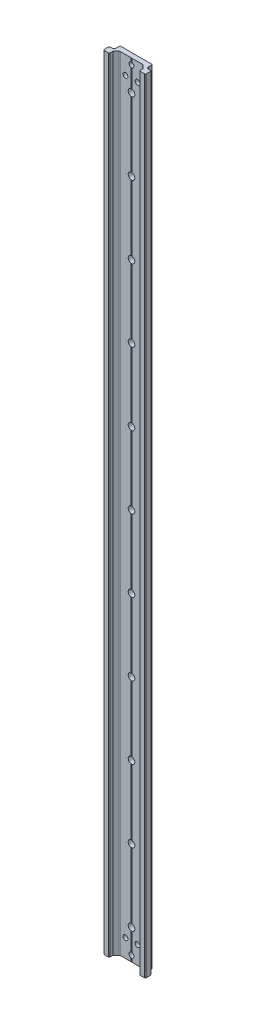
from build123d import *
from OCP.BRepFilletAPI import BRepFilletAPI_MakeChamfer

# Parameters (mm, degrees)
BOSS_EXTRU_1_DEPTH                  = 650
ENL_V_MAT_EXTRU_1_DEPTH             = 651.254758327
ENL_V_MAT_EXTRU_2_DEPTH             = 650
ENL_V_MAT_EXTRU_3_DEPTH             = 651.254758327
ENL_V_MAT_EXTRU_4_DEPTH             = 650
DIAM_TRE_DU_PER_AGE_5_5_5_5_1_D     = 5.5
DIAM_TRE_DU_PER_AGE_5_5_5_5_1_DEPTH = 9.900000103
CHANFREIN1_SIZE                     = 0.5
CHANFREIN1_SIZE2                    = 0.499999975
CHANFREIN2_SIZE                     = 0.3
CHANFREIN3_SIZE                     = 0.499999997
CHANFREIN3_SIZE2                    = 0.500000028
CHANFREIN4_SIZE                     = 0.5
CHANFREIN4_SIZE2                    = 0.500000014
CONG_1_R                            = 1.499999963
CONG_2_R                            = 1.999999944
ESQUISSE8_R                         = 2
ESQUISSE8_R_2                       = 2.093247616
ENL_V_MAT_EXTRU_5_DEPTH             = 10


with BuildPart() as part:
    # Esquisse1 → Boss.-Extru.1 (new body)
    with BuildSketch(Plane(origin=(0, 325, 0), x_dir=(1, 0, 0), z_dir=(0, 1, 0))):
        Polygon((-9.70002034, 1.00000045), (9.70002034, 1.00000045), (12.50002072, -1.79999993), (12.50002072, -4.999999928), (17.50002072, -4.999999928), (17.50002072, 5.000000175), (-17.50002072, 5.000000175), (-17.50002072, -4.999999928), (-12.50002072, -4.999999928), (-12.50002072, -1.79999993), align=None)
    extrude(amount=-BOSS_EXTRU_1_DEPTH)

    # Esquisse2 → Enlèv. mat.-Extru.1 (cut, through all)
    with BuildSketch(Plane.XZ.offset(325)):
        Polygon((-14.30002069, -6.7e-08), (-17.50002072, -6.7e-08), (-17.50002072, -5.000000175), (-13.50002072, -5.000000175), (-13.50002072, -0.799999947), align=None)
    extrude(amount=-ENL_V_MAT_EXTRU_1_DEPTH, mode=Mode.SUBTRACT)

    # Esquisse3 → Enlèv. mat.-Extru.2 (cut)
    with BuildSketch(Plane.XZ.offset(325)):
        Polygon((0.25, -1.000000175), (-0.25, -1.000000175), (1e-09, -1.144337743), align=None)
    extrude(amount=-ENL_V_MAT_EXTRU_2_DEPTH, mode=Mode.SUBTRACT)

    # Esquisse4 → Enlèv. mat.-Extru.3 (cut, through all)
    with BuildSketch(Plane.XZ.offset(325)):
        Polygon((13.50002072, -0.799999925), (13.50002072, -5.000000175), (17.50002072, -5.000000175), (17.50002072, 7.5e-08), (14.30002072, 7.5e-08), align=None)
    extrude(amount=-ENL_V_MAT_EXTRU_3_DEPTH, mode=Mode.SUBTRACT)

    # Esquisse5 → Enlèv. mat.-Extru.4 (cut)
    with BuildSketch(Plane.XZ.offset(325)):
        Polygon((-7.50002072, -5.000000175), (7.50002072, -5.000000175), (7.40002072, -4.900000175), (-7.40002072, -4.900000175), align=None)
    extrude(amount=-ENL_V_MAT_EXTRU_4_DEPTH, mode=Mode.SUBTRACT)

    # Diamètre du perçage Ø5.5 (5.5)1
    with Locations(Plane(origin=(0, 0, -4.900000175), x_dir=(-1, 0, 0), z_dir=(0, 0, -1))):
        with Locations((0, 300), (0, 240), (0, 180), (0, 120), (0, 60), (0, 0), (0, -60), (0, -120), (0, -180), (0, -240), (0, -300)):
            Hole(DIAM_TRE_DU_PER_AGE_5_5_5_5_1_D / 2, depth=DIAM_TRE_DU_PER_AGE_5_5_5_5_1_DEPTH)

    # Chanfrein1: one chamfer whose edges measure the first distance from different faces: ONE call of the kernel's chamfer builder (chamfer() names one face for all edges)
    chanfrein1_edges_1 = [part.edges().sort_by_distance(p)[0] for p in [
        (17.50002072, 0, 4.999999928),
    ]]
    chanfrein1_side_1 = [part.faces().sort_by_distance(p)[0] for p in [
        (17.50002072, 0, 2.500000001),
    ]]
    chanfrein1_edges_2 = [part.edges().sort_by_distance(p)[0] for p in [
        (-17.50002072, 0, 4.999999928),
    ]]
    chanfrein1_side_2 = [part.faces().sort_by_distance(p)[0] for p in [
        (-15.00002072, 0, 4.999999928),
    ]]
    chanfrein1 = BRepFilletAPI_MakeChamfer(part.part.solid().wrapped)
    for e in chanfrein1_edges_1:
        chanfrein1.Add(CHANFREIN1_SIZE, CHANFREIN1_SIZE2, e.wrapped, chanfrein1_side_1[0].wrapped)  # the first distance lies on this face
    for e in chanfrein1_edges_2:
        chanfrein1.Add(CHANFREIN1_SIZE, CHANFREIN1_SIZE2, e.wrapped, chanfrein1_side_2[0].wrapped)  # the first distance lies on this face
    add(Compound.cast(chanfrein1.Shape()), mode=Mode.REPLACE)

    # Chanfrein2
    chanfrein2_edges = [part.edges().sort_by_distance(p)[0] for p in [
        (-13.50002072, 0, -5.000000175),
        (13.50002072, 0, -5.000000175),
    ]]
    chamfer(chanfrein2_edges, length=CHANFREIN2_SIZE)

    # Chanfrein3: one chamfer whose edges measure the first distance from different faces: ONE call of the kernel's chamfer builder (chamfer() names one face for all edges)
    chanfrein3_edges_1 = [part.edges().sort_by_distance(p)[0] for p in [
        (12.50002072, 0, 4.999999928),
    ]]
    chanfrein3_side_1 = [part.faces().sort_by_distance(p)[0] for p in [
        (14.750020732, 0, 4.999999928),
    ]]
    chanfrein3_edges_2 = [part.edges().sort_by_distance(p)[0] for p in [
        (-17.50002072, 0, -6.7e-08),
    ]]
    chanfrein3_side_2 = [part.faces().sort_by_distance(p)[0] for p in [
        (-15.900020705, 0, -6.7e-08),
    ]]
    chanfrein3_edges_3 = [part.edges().sort_by_distance(p)[0] for p in [
        (-12.50002072, 0, 4.999999928),
    ]]
    chanfrein3_side_3 = [part.faces().sort_by_distance(p)[0] for p in [
        (-12.50002072, 0, 3.399999929),
    ]]
    chanfrein3 = BRepFilletAPI_MakeChamfer(part.part.solid().wrapped)
    for e in chanfrein3_edges_1:
        chanfrein3.Add(CHANFREIN3_SIZE, CHANFREIN3_SIZE2, e.wrapped, chanfrein3_side_1[0].wrapped)  # the first distance lies on this face
    for e in chanfrein3_edges_2:
        chanfrein3.Add(CHANFREIN3_SIZE, CHANFREIN3_SIZE2, e.wrapped, chanfrein3_side_2[0].wrapped)  # the first distance lies on this face
    for e in chanfrein3_edges_3:
        chanfrein3.Add(CHANFREIN3_SIZE, CHANFREIN3_SIZE2, e.wrapped, chanfrein3_side_3[0].wrapped)  # the first distance lies on this face
    add(Compound.cast(chanfrein3.Shape()), mode=Mode.REPLACE)

    # Chanfrein4
    chanfrein4_edges = [part.edges().sort_by_distance(p)[0] for p in [
        (17.50002072, 0, 7.5e-08),
    ]]
    chanfrein4_side = [part.faces().sort_by_distance(p)[0] for p in [
        (15.90002072, 0, 7.5e-08),
    ]]
    chamfer(chanfrein4_edges, length=CHANFREIN4_SIZE, length2=CHANFREIN4_SIZE2, reference=chanfrein4_side[0])

    # Congé1
    cong_1_edges = [part.edges().sort_by_distance(p)[0] for p in [
        (9.70002034, 0, -1.00000045),
        (-9.70002034, 0, -1.00000045),
    ]]
    fillet(cong_1_edges, radius=CONG_1_R)

    # Congé2
    cong_2_edges = [part.edges().sort_by_distance(p)[0] for p in [
        (13.50002072, 0, -0.799999925),
        (-13.50002072, 0, -0.799999947),
    ]]
    fillet(cong_2_edges, radius=CONG_2_R)

    # Esquisse8 → Enlèv. mat.-Extru.5 (cut)
    with BuildSketch(Plane.XY.offset(-1.00000045)):
        with Locations((-4.999999999, -310)):
            Circle(ESQUISSE8_R)
        with Locations((5.000000001, -310)):
            Circle(ESQUISSE8_R)
        with Locations((-4.999999999, 310)):
            Circle(ESQUISSE8_R)
        with Locations((5.000000001, 310)):
            Circle(ESQUISSE8_R)
        with Locations((0, -320)):
            Circle(ESQUISSE8_R_2)
        with Locations((0, 320)):
            Circle(ESQUISSE8_R)
    extrude(amount=-ENL_V_MAT_EXTRU_5_DEPTH, mode=Mode.SUBTRACT)


solid = part.part
